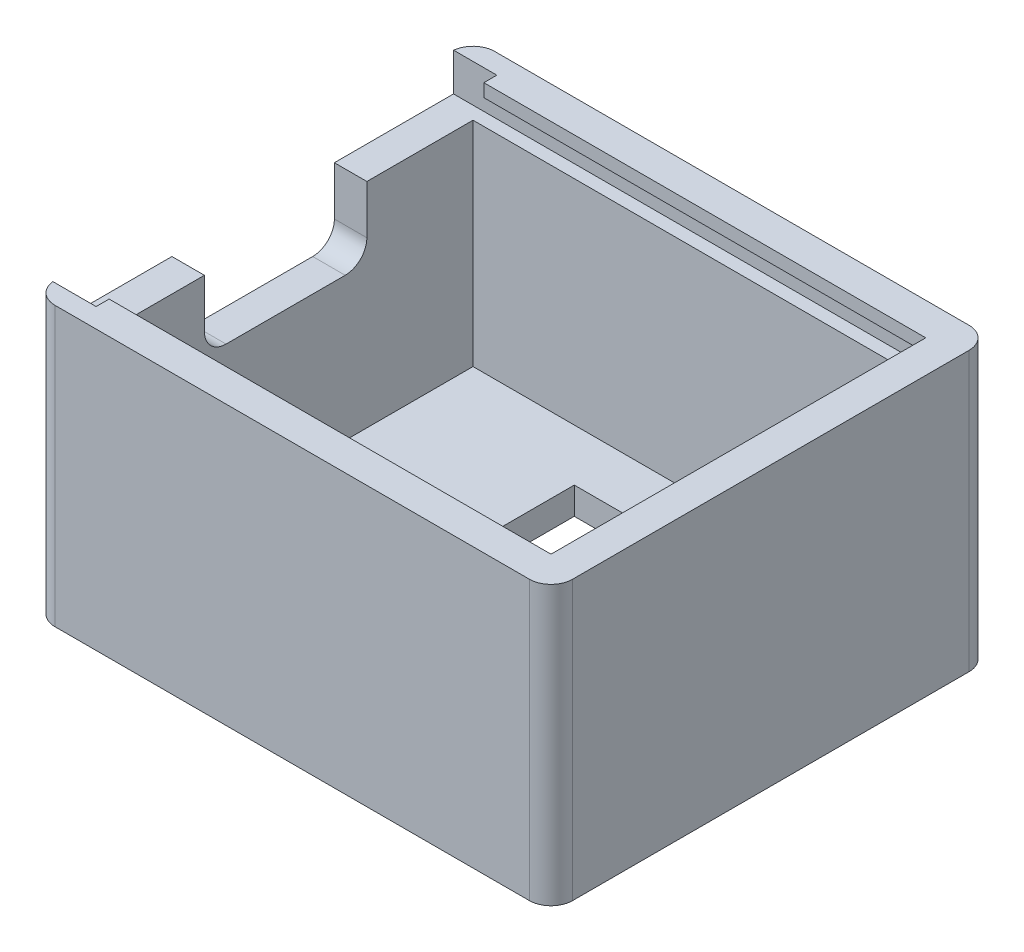
from build123d import *

# Parameters (mm, degrees)
SKETCH1_W           = 47.8
SKETCH1_H           = 40.6
BOSS_EXTRUDE1_DEPTH = 25.7
SKETCH2_W           = 41.8
SKETCH2_H           = 34.6
CUT_EXTRUDE1_DEPTH  = 23.2
FILLET1_R           = 2
SKETCH3_W           = 25
SKETCH3_H           = 25
CUT_EXTRUDE2_DEPTH  = 40.006922463
CUT_EXTRUDE3_START  = 22.2
SKETCH4_W           = 47
SKETCH4_H           = 37
CUT_EXTRUDE3_DEPTH  = 2.3
SKETCH6_W           = 37
SKETCH6_H           = 3.5
CUT_EXTRUDE4_DEPTH  = 4
SKETCH7_W           = 15
SKETCH7_H           = 13
CUT_EXTRUDE5_DEPTH  = 4
FILLET2_R           = 2


with BuildPart() as part:
    # Sketch1 → Boss-Extrude1 (new body)
    with BuildSketch(Plane(origin=(0, 0, 0), x_dir=(1, 0, 0), z_dir=(0, 1, 0))):
        Rectangle(SKETCH1_W, SKETCH1_H)
    extrude(amount=BOSS_EXTRUDE1_DEPTH)

    # Sketch2 → Cut-Extrude1 (cut)
    with BuildSketch(Plane(origin=(0, 25.7, 0), x_dir=(1, 0, 0), z_dir=(0, 1, 0))):
        Rectangle(SKETCH2_W, SKETCH2_H)
    extrude(amount=-CUT_EXTRUDE1_DEPTH, mode=Mode.SUBTRACT)

    # Fillet1
    fillet1_edges = [part.edges().sort_by_distance(p)[0] for p in [
        (23.9, 12.85, -20.3),
        (-23.9, 12.85, -20.3),
        (-23.9, 12.85, 20.3),
        (23.9, 12.85, 20.3),
    ]]
    fillet(fillet1_edges, radius=FILLET1_R)

    # Sketch3 → Cut-Extrude2 (cut, through all)
    with BuildSketch(Plane(origin=(0, 2.5, 0), x_dir=(1, 0, 0), z_dir=(0, 1, 0))):
        with Locations((5.75, 0)):
            Rectangle(SKETCH3_W, SKETCH3_H)
    extrude(amount=-CUT_EXTRUDE2_DEPTH, mode=Mode.SUBTRACT)

    # Sketch4 → Cut-Extrude3 (cut)
    with BuildSketch(Plane(origin=(0, 0, 0), x_dir=(1, 0, 0), z_dir=(0, 1, 0)).offset(CUT_EXTRUDE3_START)):
        with Locations((-1.4, 0)):
            Rectangle(SKETCH4_W, SKETCH4_H)
    extrude(amount=CUT_EXTRUDE3_DEPTH, mode=Mode.SUBTRACT)

    # Sketch6 → Cut-Extrude4 (cut)
    with BuildSketch(Plane.ZY.offset(23.9)):
        with Locations((0, 25.7)):
            Rectangle(SKETCH6_W, SKETCH6_H)
    extrude(amount=-CUT_EXTRUDE4_DEPTH, mode=Mode.SUBTRACT)

    # Sketch7 → Cut-Extrude5 (cut)
    with BuildSketch(Plane.ZY.offset(23.9)):
        with Locations((0, 22.2)):
            Rectangle(SKETCH7_W, SKETCH7_H)
    extrude(amount=-CUT_EXTRUDE5_DEPTH, mode=Mode.SUBTRACT)

    # Fillet2
    fillet2_edges = [part.edges().sort_by_distance(p)[0] for p in [
        (-22.4, 15.7, 7.5),
        (-22.4, 15.7, -7.5),
    ]]
    fillet(fillet2_edges, radius=FILLET2_R)


solid = part.part
